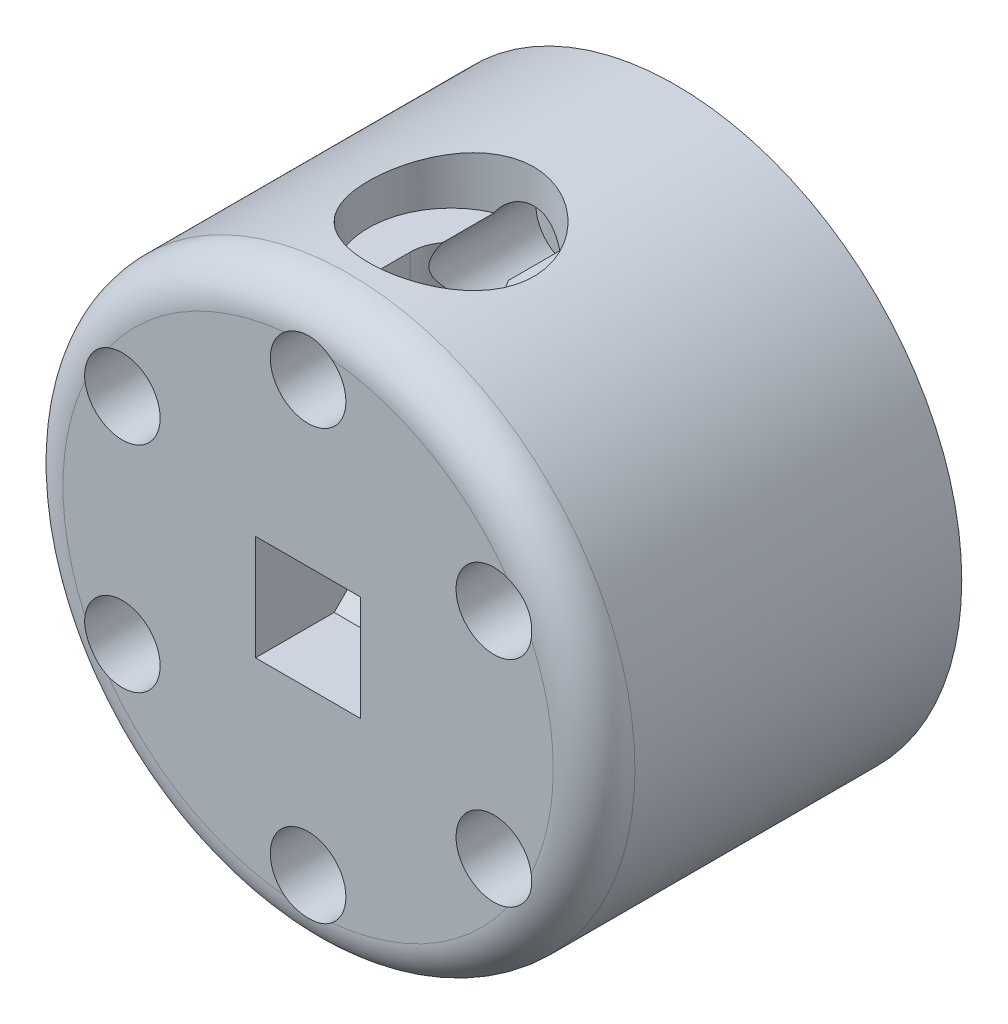
from build123d import *

# Parameters (mm, degrees)
SKETCH_1_R           = 14
EXTRUDE_1_DEPTH      = 22
SKETCH_3_R           = 7.35
CUT_EXTRUDE_1_DEPTH  = 6
SKETCH_2_R           = 1.1
CUT_EXTRUDE_2_DEPTH  = 32
SKETCH_4_R           = 1.85
CUT_EXTRUDE_3_DEPTH  = 17
SKETCH_5_W           = 5.15
SKETCH_5_H           = 5.15
CUT_EXTRUDE_4_DEPTH  = 13
EXTRUDE_2_REACH      = 32.899
CUT_EXTRUDE_7_DEPTH  = 20
SKETCH_11_R          = 4.05
CUT_EXTRUDE_8_DEPTH  = 2
SKETCH_12_R          = 19.208398283
CUT_EXTRUDE_9_DEPTH  = 4
SKETCH_13_R          = 1.5
CUT_EXTRUDE_10_DEPTH = 23
FILLET_1_R           = 2


with BuildPart() as part:
    # 草图1 → 凸台-拉伸1 (new body)
    with BuildSketch(Plane.XY):
        Circle(SKETCH_1_R)
    extrude(amount=EXTRUDE_1_DEPTH)

    # 草图3 → 切除-拉伸1 (cut)
    with BuildSketch(Plane(origin=(0, 0, 0), x_dir=(-1, 0, 0), z_dir=(0, 0, -1))):
        Circle(SKETCH_3_R)
    extrude(amount=-CUT_EXTRUDE_1_DEPTH, mode=Mode.SUBTRACT)

    # 草图2 → 切除-拉伸2 (cut)
    with BuildSketch(Plane.XY.offset(22)):
        with Locations((-9.09326674, -5.25)):
            Circle(SKETCH_2_R)
        with Locations((-9.09326674, 5.25)):
            Circle(SKETCH_2_R)
        with Locations((0, 10.5)):
            Circle(SKETCH_2_R)
        with Locations((9.09326674, 5.25)):
            Circle(SKETCH_2_R)
        with Locations((9.09326674, -5.25)):
            Circle(SKETCH_2_R)
        with Locations((0, -10.5)):
            Circle(SKETCH_2_R)
    extrude(amount=-CUT_EXTRUDE_2_DEPTH, mode=Mode.SUBTRACT)

    # 草图4 → 切除-拉伸3 (cut)
    with BuildSketch(Plane.XY.offset(22)):
        with Locations((9.09326674, 5.25)):
            Circle(SKETCH_4_R)
        with Locations((9.09326674, -5.25)):
            Circle(SKETCH_4_R)
        with Locations((0, -10.5)):
            Circle(SKETCH_4_R)
        with Locations((-9.09326674, -5.25)):
            Circle(SKETCH_4_R)
        with Locations((-9.09326674, 5.25)):
            Circle(SKETCH_4_R)
        with Locations((0, 10.5)):
            Circle(SKETCH_4_R)
    extrude(amount=-CUT_EXTRUDE_3_DEPTH, mode=Mode.SUBTRACT)

    # 草图5 → 切除-拉伸4 (cut)
    with BuildSketch(Plane.XY.offset(22)):
        Rectangle(SKETCH_5_W, SKETCH_5_H)
    extrude(amount=-CUT_EXTRUDE_4_DEPTH, mode=Mode.SUBTRACT)

    # 草图6 → 凸台-拉伸2 (add, up to next)
    with BuildSketch(Plane(origin=(-2.575, 0, 0), x_dir=(0, 0, -1), z_dir=(1, 0, 0)), mode=Mode.PRIVATE) as extrude_2_sk1:
        Polygon((-9, -2.575), (-14.15, -2.575), (-9, 2.575), align=None)
    extrude_2_tool1 = extrude(extrude_2_sk1.sketch, amount=EXTRUDE_2_REACH, mode=Mode.PRIVATE) - part.part
    add(extrude_2_tool1.solids().sort_by_distance((-2.575, -0.858333, 10.716667))[0])

    # 草图9 → 切除-拉伸7 (cut)
    with BuildSketch(Plane(origin=(0, 2.575, 0), x_dir=(-1, 0, 0), z_dir=(0, -1, 0))):
        with BuildLine():
            Line((2, -11), (2, -13))
            ThreePointArc((2, -13), (0, -15), (-2, -13))
            Line((-2, -13), (-2, -11))
            ThreePointArc((-2, -11), (0, -9), (2, -11))
        make_face()
    extrude(amount=-CUT_EXTRUDE_7_DEPTH, mode=Mode.SUBTRACT)

    # 草图11 → 切除-拉伸8 (cut, symmetric)
    with BuildSketch(Plane(origin=(0, 13.416407865, 0), x_dir=(1, 0, 0), z_dir=(0, 1, 0))):
        with Locations(Location((0, -11, 0), (0, 0, 90))):
            Circle(SKETCH_11_R)
    extrude(amount=CUT_EXTRUDE_8_DEPTH, both=True, mode=Mode.SUBTRACT)

    # 草图12 → 切除-拉伸9 (cut)
    with BuildSketch(Plane.XY.offset(22)):
        Circle(SKETCH_12_R)
    extrude(amount=-CUT_EXTRUDE_9_DEPTH, mode=Mode.SUBTRACT)

    # 草图13 → 切除-拉伸10 (cut)
    with BuildSketch(Plane(origin=(0, 2.575, 0), x_dir=(-1, 0, 0), z_dir=(0, -1, 0))):
        with Locations(Location((0, -11, 0), (0, 0, 270))):
            Circle(SKETCH_13_R)
    extrude(amount=CUT_EXTRUDE_10_DEPTH, mode=Mode.SUBTRACT)

    # 圆角1
    # the kernel refuses this fillet: 2 mm, written as the material it takes off along each edge
    with BuildSketch(Plane(origin=(0, 0, 18), x_dir=(1, 0, 0), z_dir=(0, 1, 0))) as fillet_1_piece_1:
        with BuildLine():
            CenterArc((14 - FILLET_1_R, FILLET_1_R), FILLET_1_R, 270, 90)
            Line((14, FILLET_1_R), (14, 0))
            Line((14, 0), (14 - FILLET_1_R, 0))
        make_face()
    revolve(axis=Axis((0, 0, 18), (0, 0, -1)), mode=Mode.SUBTRACT)


solid = part.part
